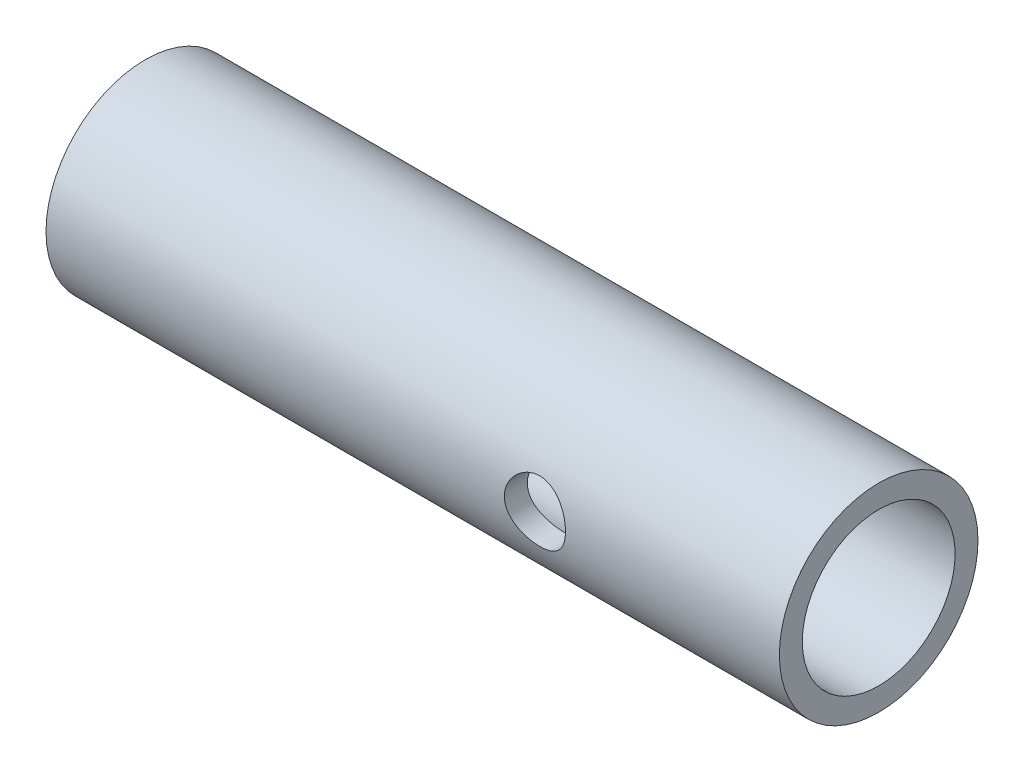
from build123d import *

# Parameters (mm, degrees)
SKETCH1_W               = 152.4
SKETCH1_H               = 4.7625
CUT_EXTRUDE1_DEPTH      = 156.169497043
CUT_EXTRUDE1_DEPTH_BACK = 156.169497043
SKETCH2_R               = 6.35


with BuildPart() as part:
    # Sketch1 → Revolve1 (revolve)
    with BuildSketch(Plane.XY):
        with Locations((76.2, 18.25625)):
            Rectangle(SKETCH1_W, SKETCH1_H)
    revolve(axis=Axis((0, 0, 0), (1, 0, 0)))

    # Sketch2 → Cut-Extrude1 (cut, two sides: drawn at the far end of the back side and taken through both)
    with BuildSketch(Plane.XY.offset(-CUT_EXTRUDE1_DEPTH_BACK)):
        with Locations((101.6, 0)):
            Circle(SKETCH2_R)
    extrude(amount=CUT_EXTRUDE1_DEPTH + CUT_EXTRUDE1_DEPTH_BACK, mode=Mode.SUBTRACT)


solid = part.part
